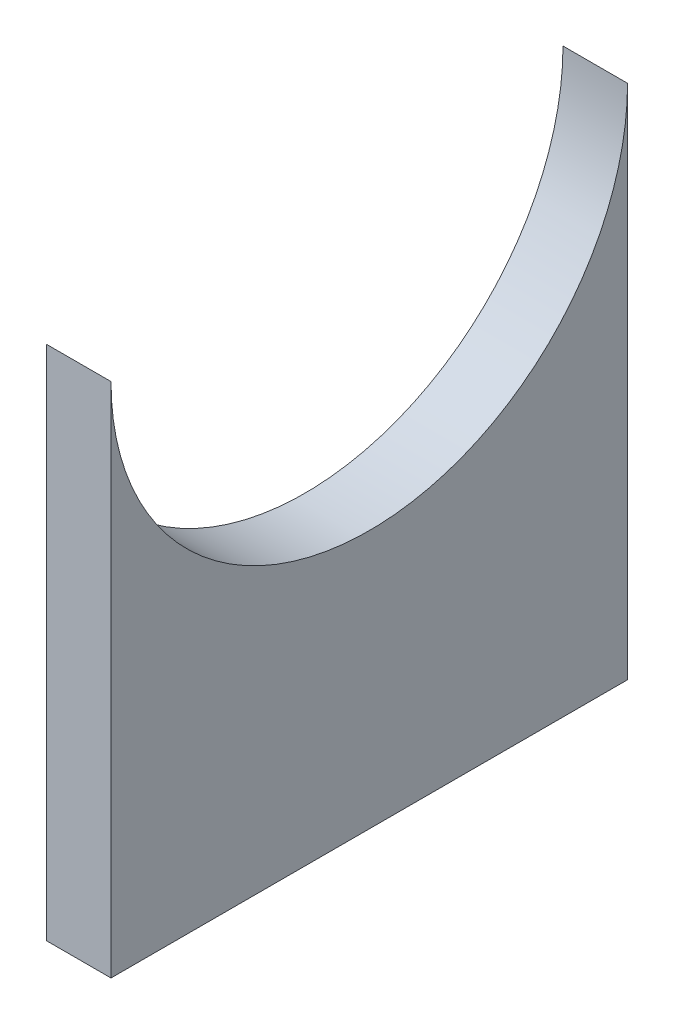
from build123d import *

# Parameters (mm, degrees)
BOSS_EXTRUDE1_DEPTH = 3.175


with BuildPart() as part:
    # Sketch1 → Boss-Extrude1 (new body)
    with BuildSketch(Plane(origin=(0, 0, 0), x_dir=(0, 0, -1), z_dir=(1, 0, 0))):
        with BuildLine():
            Line((-12.7, -12.7), (12.7, -12.7))
            Line((12.7, -12.7), (12.7, 12.7))
            ThreePointArc((12.7, 12.7), (0, 0), (-12.7, 12.7))
            Line((-12.7, 12.7), (-12.7, -12.7))
        make_face()
    extrude(amount=BOSS_EXTRUDE1_DEPTH)


solid = part.part
